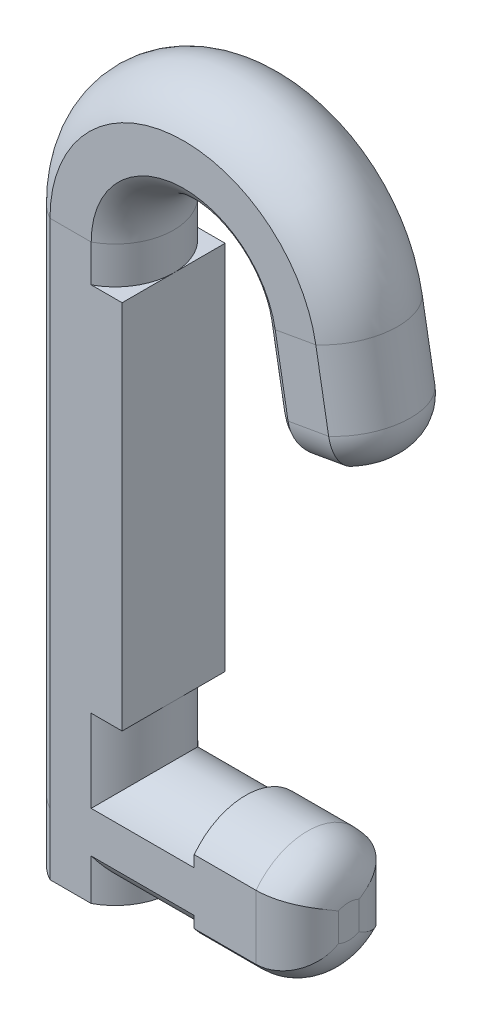
from build123d import *

# Parameters (mm, degrees)
EXTRUDE_1_DEPTH = 5
SKETCH_19_W     = 5
SKETCH_19_H     = 18
EXTRUDE_2_DEPTH = 1.5
FILLET_2_R      = 2


with BuildPart() as part:
    # 扫描2: sweep along a path in 草图1
    with BuildLine(Plane.XY) as sweep_2_path:
        Line((11.886241035, 20.255064977), (10.916442642, 25.755064977))
        ThreePointArc((10.916442642, 25.755064977), (5.020643415, 30.27907084), (0, 24.8))
        Line((0, 24.8), (0, 0))
        Line((0, 0), (0, -3))
    # 草图13 → 扫描2 (sweep)
    with BuildSketch(Plane(origin=(0, -3, 0), x_dir=(1, 0, 0), z_dir=(0, 1, 0))):
        with BuildLine():
            Line((-1, -2.5), (1, -2.5))
            ThreePointArc((1, -2.5), (2.5, 0), (1, 2.5))
            Line((1, 2.5), (-1, 2.5))
            ThreePointArc((-1, 2.5), (-2.5, 0), (-1, -2.5))
        make_face()
    sweep(path=sweep_2_path.line)

    # 扫描4: sweep along a path in 草图15
    with BuildLine(Plane.XY) as sweep_4_path:
        Line((0, 0), (11, 0))
    # 草图16 → 扫描4 (sweep)
    with BuildSketch(Plane(origin=(11, 0, 0), x_dir=(0, 0, -1), z_dir=(1, 0, 0))):
        with BuildLine():
            Line((-2.5, -1), (-2.5, 1))
            ThreePointArc((-2.5, 1), (0, 2.5), (2.5, 1))
            Line((2.5, 1), (2.5, -1))
            ThreePointArc((2.5, -1), (0, -2.5), (-2.5, -1))
        make_face()
    sweep(path=sweep_4_path.line)

    # 草图17 → 凸台-拉伸1 (add)
    with BuildSketch(Plane(origin=(11, 0, 0), x_dir=(0, 0, -1), z_dir=(1, 0, 0))):
        with BuildLine():
            Line((-2.5, 1.555522876), (-2.5, -1.555522876))
            ThreePointArc((-2.5, -1.555522876), (0, -2.8), (2.5, -1.555522876))
            Line((2.5, -1.555522876), (2.5, 1.555522876))
            ThreePointArc((2.5, 1.555522876), (0, 2.8), (-2.5, 1.555522876))
        make_face()
    extrude(amount=-EXTRUDE_1_DEPTH)

    # 草图19 → 凸台-拉伸2 (add)
    with BuildSketch(Plane(origin=(1, 0, 0), x_dir=(0, 0, -1), z_dir=(1, 0, 0))):
        with Locations((0, 14)):
            Rectangle(SKETCH_19_W, SKETCH_19_H)
    extrude(amount=EXTRUDE_2_DEPTH)

    # 圆角2
    # the kernel refuses this fillet: 2 mm, written as the material it takes off along each edge
    with BuildSketch(Plane(origin=(17.795087554, 21.296954043, 2.5), x_dir=(0, 0, -1), z_dir=(-0.9848077530122092, -0.17364817766692373, 0))) as fillet_2_piece_1:
        with BuildLine():
            CenterArc((FILLET_2_R, -FILLET_2_R), FILLET_2_R, 90, 90)
            Line((0, -FILLET_2_R), (0, 0))
            Line((0, 0), (FILLET_2_R, 0))
        make_face()
    extrude(amount=12, mode=Mode.SUBTRACT)
    with BuildSketch(Plane(origin=(12.214510286, 20.312947703, 0), x_dir=(0.9423506208781959, 0.16616183974819204, -0.29045748456869663), z_dir=(0.2860447827236766, 0.05043741288507259, 0.9568878981667733))) as fillet_2_piece_2:
        with BuildLine():
            CenterArc((2.833333333 - FILLET_2_R, FILLET_2_R), FILLET_2_R, 270, 90)
            Line((2.833333333 - FILLET_2_R, 0), (2.833333333, 0))
            Line((2.833333333, 0), (2.833333333, FILLET_2_R))
        make_face()
    revolve(axis=Axis((12.214510286, 20.312947703, 0), (-0.173648177666923, 0.9848077530122094, 0)), revolution_arc=326.229306127, mode=Mode.SUBTRACT)
    with BuildSketch(Plane(origin=(5.977394517, 19.213175911, -2.5), x_dir=(-0.17364817766692373, 0.9848077530122092, 0), z_dir=(0.9848077530122092, 0.17364817766692373, 0))) as fillet_2_piece_3:
        with BuildLine():
            CenterArc((FILLET_2_R, FILLET_2_R), FILLET_2_R, 180, 90)
            Line((0, FILLET_2_R), (0, 0))
            Line((0, 0), (FILLET_2_R, 0))
        make_face()
    extrude(amount=12, mode=Mode.SUBTRACT)
    with BuildSketch(Plane(origin=(11, -6.555522876, 2.5), x_dir=(0, 0, -1), z_dir=(0, 1, 0))) as fillet_2_piece_4:
        with BuildLine():
            CenterArc((FILLET_2_R, FILLET_2_R), FILLET_2_R, 180, 90)
            Line((0, FILLET_2_R), (0, 0))
            Line((0, 0), (FILLET_2_R, 0))
        make_face()
    extrude(amount=13.111045751, mode=Mode.SUBTRACT)
    with BuildSketch(Plane(origin=(11, 6.555522876, -2.5), x_dir=(-1, 0, 0), z_dir=(0, -1, 0))) as fillet_2_piece_5:
        with BuildLine():
            CenterArc((FILLET_2_R, -FILLET_2_R), FILLET_2_R, 90, 90)
            Line((0, -FILLET_2_R), (0, 0))
            Line((0, 0), (FILLET_2_R, 0))
        make_face()
    extrude(amount=13.111045751, mode=Mode.SUBTRACT)
    with BuildSketch(Plane(origin=(11, -0.333333333, 0), x_dir=(0, -0.8131785022115455, -0.582014367125922), z_dir=(0, -0.582014367125922, 0.8131785022115455))) as fillet_2_piece_6:
        with BuildLine():
            CenterArc((3.133333333 - FILLET_2_R, -FILLET_2_R), FILLET_2_R, 0, 90)
            Line((3.133333333, -FILLET_2_R), (3.133333333, 0))
            Line((3.133333333, 0), (3.133333333 - FILLET_2_R, 0))
        make_face()
    revolve(axis=Axis((11, -0.333333333, 0), (1, 0, 0)), revolution_arc=288.815304863, mode=Mode.SUBTRACT)
    with BuildSketch(Plane(origin=(11, 0.333333333, 0), x_dir=(0, 0.8131785022115376, 0.5820143671259329), z_dir=(0, 0.5820143671259329, -0.8131785022115376))) as fillet_2_piece_7:
        with BuildLine():
            CenterArc((3.133333333 - FILLET_2_R, -FILLET_2_R), FILLET_2_R, 0, 90)
            Line((3.133333333 - FILLET_2_R, 0), (3.133333333, 0))
            Line((3.133333333, 0), (3.133333333, -FILLET_2_R))
        make_face()
    revolve(axis=Axis((11, 0.333333333, 0), (1, 0, 0)), revolution_arc=288.815304863, mode=Mode.SUBTRACT)
    with BuildSketch(Plane(origin=(11.557971784, 20.197182251, 0), x_dir=(-0.9423506208781961, -0.16616183974819207, 0.2904574845686964), z_dir=(-0.2860447827236764, -0.05043741288507257, -0.9568878981667737))) as fillet_2_piece_8:
        with BuildLine():
            CenterArc((2.833333333 - FILLET_2_R, FILLET_2_R), FILLET_2_R, 270, 90)
            Line((2.833333333, FILLET_2_R), (2.833333333, 0))
            Line((2.833333333, 0), (2.833333333 - FILLET_2_R, 0))
        make_face()
    revolve(axis=Axis((11.557971784, 20.197182251, 0), (-0.17364817766692306, 0.9848077530122095, 0)), revolution_arc=326.229306127, mode=Mode.SUBTRACT)


solid = part.part
